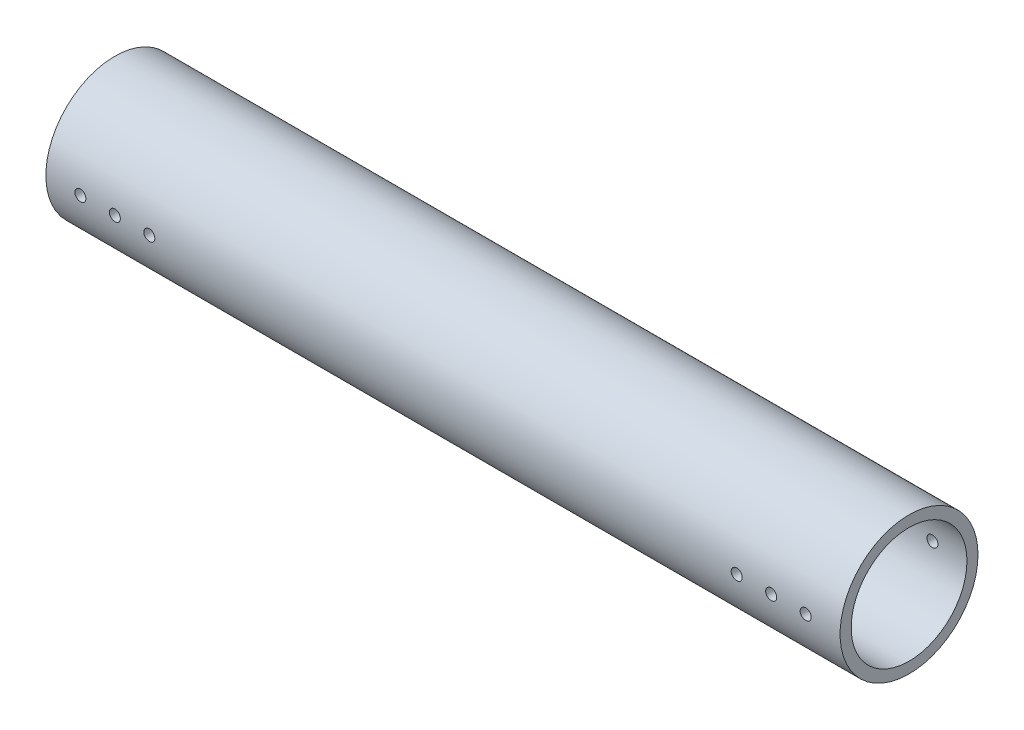
from build123d import *

# Parameters (mm, degrees)
SKETCH_2_R               = 25
SKETCH_2_R_2             = 21
EXTRUDE_2_DEPTH          = 288
CUT_EXTRUDE_2_DEPTH      = 10
CUT_EXTRUDE_2_DEPTH_BACK = 294.375186408
SKETCH_4_R               = 2


with BuildPart() as part:
    # Эскиз2 → Бобышка-Вытянуть2 (new body)
    with BuildSketch(Plane(origin=(0, 0, 0), x_dir=(0, 0, -1), z_dir=(1, 0, 0))):
        Circle(SKETCH_2_R)
        Circle(SKETCH_2_R_2, mode=Mode.SUBTRACT)
    extrude(amount=EXTRUDE_2_DEPTH)

    # Эскиз4 → Вырез-Вытянуть2 (cut, two sides: drawn at the far end of the back side and taken through both)
    with BuildSketch(Plane.XY.offset(25).offset(-CUT_EXTRUDE_2_DEPTH_BACK)):
        with Locations((12.5, 0)):
            Circle(SKETCH_4_R)
        with Locations((275.5, 0)):
            Circle(SKETCH_4_R)
        with Locations((25, 0)):
            Circle(SKETCH_4_R)
        with Locations((37.5, 0)):
            Circle(SKETCH_4_R)
        with Locations((263, 0)):
            Circle(SKETCH_4_R)
        with Locations((250.5, 0)):
            Circle(SKETCH_4_R)
    extrude(amount=CUT_EXTRUDE_2_DEPTH + CUT_EXTRUDE_2_DEPTH_BACK, mode=Mode.SUBTRACT)


solid = part.part
